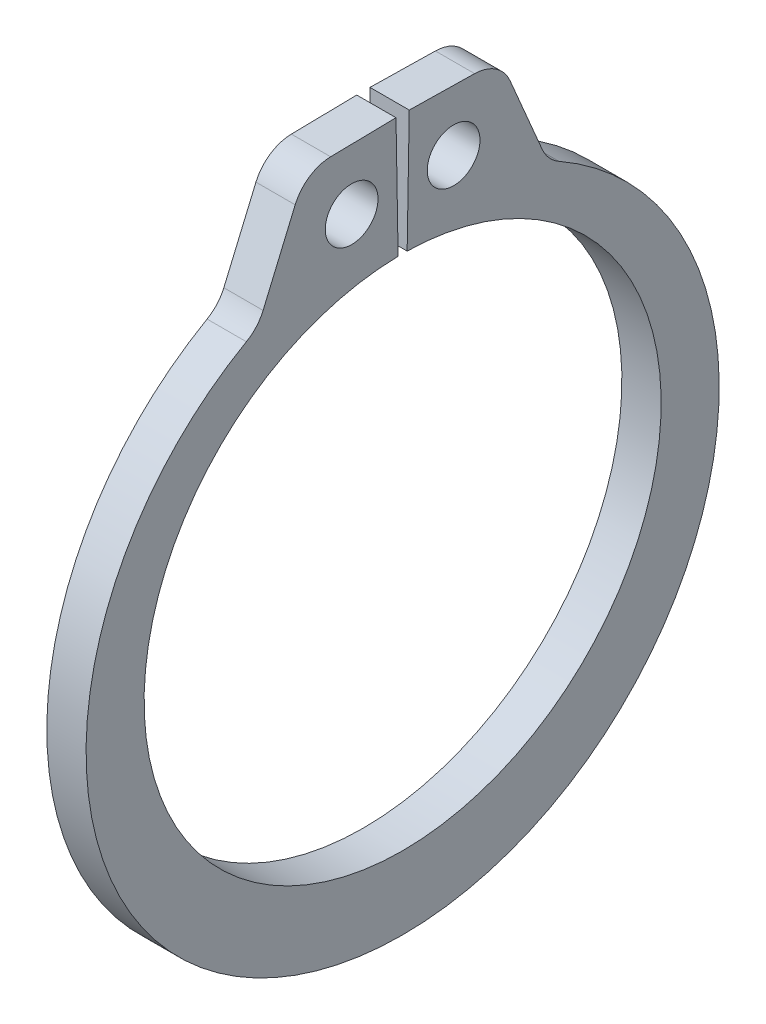
from build123d import *

# Parameters (mm, degrees)
SKETCH1_R      = 0.5969
EXTRUDE1_DEPTH = 0.4445
FILLET1_R      = 0.889


with BuildPart() as part:
    # Sketch1 → Extrude1 (new, symmetric)
    with BuildSketch(Plane(origin=(0, 0, 0), x_dir=(0, 0, -1), z_dir=(1, 0, 0))):
        with BuildLine():
            Line((-0.102178604, 5.853808301), (-0.150054045, 8.596590498))
            Line((-0.150054045, 8.596590498), (-2.207140693, 8.560683917))
            Line((-2.207140693, 8.560683917), (-3.281285866, 6.036528932))
            ThreePointArc((-3.281285866, 6.036528932), (0, -7.5057), (3.281285866, 6.036528932))
            Line((3.281285866, 6.036528932), (2.207140693, 8.560683917))
            Line((2.207140693, 8.560683917), (0.150054045, 8.596590498))
            Line((0.150054045, 8.596590498), (0.102178604, 5.853808301))
            ThreePointArc((0.102178604, 5.853808301), (0, -5.8547), (-0.102178604, 5.853808301))
        make_face()
        with Locations((-1.154659649, 7.207246109)):
            Circle(SKETCH1_R, mode=Mode.SUBTRACT)
        with Locations((1.154659649, 7.207246109)):
            Circle(SKETCH1_R, mode=Mode.SUBTRACT)
    extrude(amount=EXTRUDE1_DEPTH, both=True)

    # Fillet1
    fillet1_edges = [part.edges().sort_by_distance(p)[0] for p in [
        (0, 6.036528932, 3.281285866),
        (0, 6.036528932, -3.281285866),
        (0, 8.560683917, 2.207140693),
        (0, 8.560683917, -2.207140693),
    ]]
    fillet(fillet1_edges, radius=FILLET1_R)


solid = part.part
